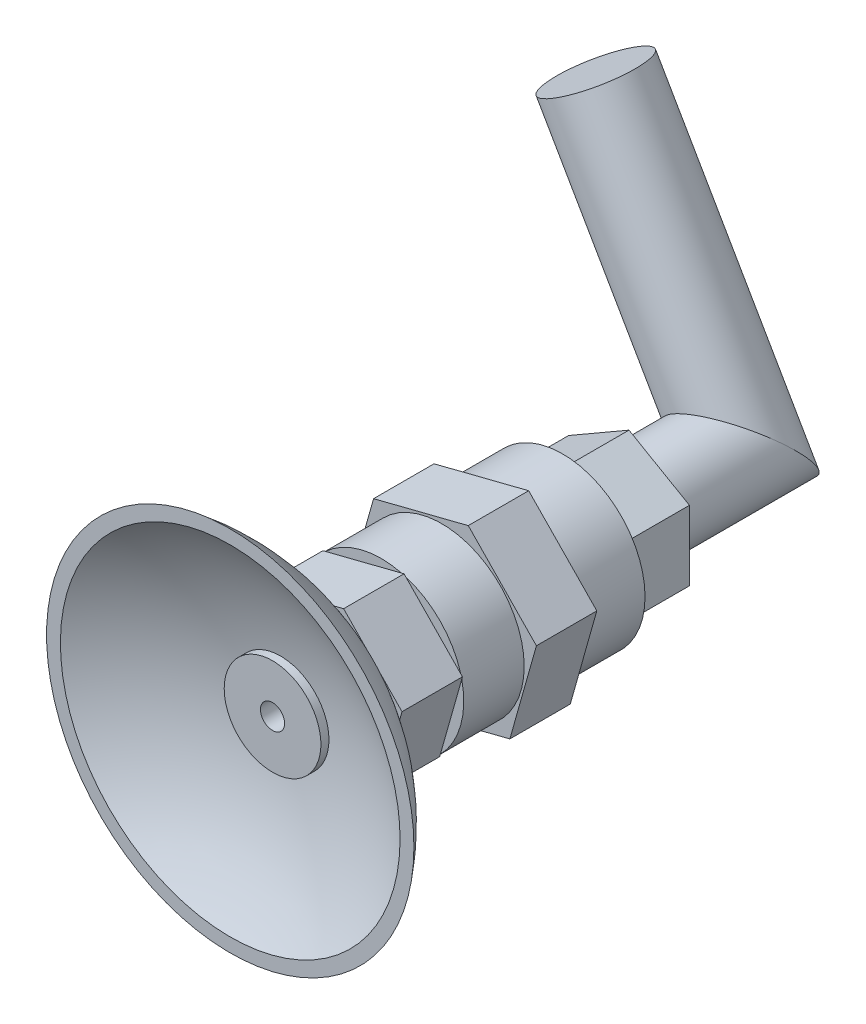
from build123d import *
from build123d.topology import SkipClean

# Parameters (mm, degrees)
ESQUISSE1_R             = 6.825
BOSS_EXTRU_1_DEPTH      = 5
BOSS_EXTRU_2_DEPTH      = 5
ESQUISSE3_R             = 6.825
BOSS_EXTRU_3_DEPTH      = 5
BOSS_EXTRU_4_DEPTH      = 5
ESQUISSE5_R             = 6
BOSS_EXTRU_5_DEPTH      = 1
ESQUISSE8_R             = 4
BOSS_EXTRU_6_DEPTH      = 4
COQUE1_START            = 3
COQUE1_OUTLINE_R        = 3
COQUE1_DEPTH            = 17.019936639
COQUE1_2_OUTLINE_R      = 3.825
COQUE1_2_OUTLINE_R_2    = 3
COQUE1_2_DEPTH          = 9
COQUE1_START_2          = 12
COQUE1_3_DEPTH          = 5
COQUE1_START_3          = 17
COQUE1_4_OUTLINE_R      = 1
COQUE1_4_DEPTH          = 7
BOSS_EXTRU_7_DEPTH      = 5.5
ESQUISSE11_R            = 3.75
BOSS_EXTRU_8_DEPTH      = 13
BOSS_EXTRU_9_DEPTH      = 19
BOSS_EXTRU_9_DEPTH_BACK = 11
ESQUISSE15_R            = 3.75
ENL_V_MAT_EXTRU_1_DEPTH = 36
ENL_V_MAT_EXTRU_2_DEPTH = 24


with BuildPart() as part:
    # Esquisse1 → Boss.-Extru.1 (new body)
    with BuildSketch(Plane.XY):
        Circle(ESQUISSE1_R)
    extrude(amount=BOSS_EXTRU_1_DEPTH)

    # Esquisse2 → Boss.-Extru.2 (add)
    with BuildSketch(Plane.XY.offset(5)):
        Polygon((2.197146908, 7.778552487), (-5.637850605, 5.792061282), (-7.834997513, -1.986491205), (-2.197146908, -7.778552487), (5.637850605, -5.792061282), (7.834997513, 1.986491205), align=None)
    extrude(amount=BOSS_EXTRU_2_DEPTH)

    # Esquisse3 → Boss.-Extru.3 (add)
    with BuildSketch(Plane.XY.offset(10)):
        Circle(ESQUISSE3_R)
    extrude(amount=BOSS_EXTRU_3_DEPTH)

    # Esquisse4 → Boss.-Extru.4 (add)
    with BuildSketch(Plane.XY.offset(15)):
        Polygon((1.883268778, 6.667330703), (-4.832443375, 4.964623956), (-6.715712154, -1.702706748), (-1.883268778, -6.667330703), (4.832443375, -4.964623956), (6.715712154, 1.702706748), align=None)
    extrude(amount=BOSS_EXTRU_4_DEPTH)

    # Esquisse5 → Boss.-Extru.5 (add)
    with BuildSketch(Plane.XY.offset(20)):
        with Locations(Location((0, 0, 0), (0, 0, 164.227020734))):
            Circle(ESQUISSE5_R)
    extrude(amount=BOSS_EXTRU_5_DEPTH)

    # Esquisse6 → Révolution1 (revolve)
    with BuildSketch(Plane(origin=(0, 0, 0), x_dir=(0, 0, 1), z_dir=(-0.9623462940986051, 0.2718264340248778, 0))):
        with BuildLine():
            Line((27.5, 15.2), (27.5, 14.053156671))
            ThreePointArc((27.5, 14.053156671), (24.153582084, 7.377792349), (23.001548337, 0))
            Line((23.001548337, 0), (20.000668758, 0))
            ThreePointArc((20.000668758, 0), (22.010684231, 8.458303467), (27.5, 15.2))
        make_face()
    revolve(axis=Axis((0, 0, 27.429189789), (0, 0, -1)))

    # Esquisse8 → Boss.-Extru.6 (add)
    with BuildSketch(Plane(origin=(0, 0, 20), x_dir=(-1, 0, 0), z_dir=(0, 0, -1))):
        Circle(ESQUISSE8_R)
    extrude(amount=-BOSS_EXTRU_6_DEPTH)

    # Coque1: read off the stored shape, not the designer's step
    # Coque1 outline → Coque1 (cut)
    with BuildSketch(Plane.XY.offset(COQUE1_START)):
        Circle(COQUE1_OUTLINE_R)
    extrude(amount=COQUE1_DEPTH, mode=Mode.SUBTRACT)

    # Coque1 2 outline → Coque1 2 (cut)
    with BuildSketch(Plane.XY.offset(COQUE1_START)):
        Circle(COQUE1_2_OUTLINE_R)
        Circle(COQUE1_2_OUTLINE_R_2, mode=Mode.SUBTRACT)
    extrude(amount=COQUE1_2_DEPTH, mode=Mode.SUBTRACT)

    # Coque1 3 outline → Coque1 3 (cut)
    with BuildSketch(Plane.XY.offset(COQUE1_START_2)):
        with BuildLine():
            Line((-2.887038883, 0.815479301), (-3.357856077, -0.851353374))
            Line((-3.357856077, -0.851353374), (-2.149745259, -2.092509336))
            ThreePointArc((-2.149745259, -2.092509336), (-2.907988669, -0.737293632), (-2.887038883, 0.815479301))
        make_face()
        with BuildLine():
            Line((-2.416221688, 2.482311978), (-2.887038883, 0.815479301))
            ThreePointArc((-2.887038883, 0.815479301), (-2.092509359, 2.149745237), (-0.737293637, 2.907988668))
            Line((-0.737293637, 2.907988668), (-2.416221688, 2.482311978))
        make_face()
        with BuildLine():
            ThreePointArc((0.737293647, -2.907988665), (-0.815479321, -2.887038877), (-2.149745259, -2.092509336))
            Line((-2.149745259, -2.092509336), (-0.941634389, -3.333665352))
            Line((-0.941634389, -3.333665352), (0.737293647, -2.907988665))
        make_face()
        with BuildLine():
            Line((0.941634389, 3.333665352), (-0.737293637, 2.907988668))
            ThreePointArc((-0.737293637, 2.907988668), (0.815479327, 2.887038875), (2.149745261, 2.092509334))
            Line((2.149745261, 2.092509334), (0.941634389, 3.333665352))
        make_face()
        with BuildLine():
            ThreePointArc((2.887038882, -0.815479302), (2.092509362, -2.149745234), (0.737293647, -2.907988665))
            Line((0.737293647, -2.907988665), (2.416221688, -2.482311978))
            Line((2.416221688, -2.482311978), (2.887038882, -0.815479302))
        make_face()
        with BuildLine():
            Line((3.357856077, 0.851353374), (2.149745261, 2.092509334))
            ThreePointArc((2.149745261, 2.092509334), (2.90798867, 0.73729363), (2.887038882, -0.815479302))
            Line((2.887038882, -0.815479302), (3.357856077, 0.851353374))
        make_face()
    extrude(amount=COQUE1_3_DEPTH, mode=Mode.SUBTRACT)

    # Coque1 4 outline → Coque1 4 (cut)
    with BuildSketch(Plane.XY.offset(COQUE1_START_3)):
        Circle(COQUE1_4_OUTLINE_R)
    extrude(amount=COQUE1_4_DEPTH, mode=Mode.SUBTRACT)

    # Coque1 5 outline → Coque1 5 (revolve, cut)
    with BuildSketch(Plane.XZ):
        with BuildLine():
            ThreePointArc((3.000000027, 20.167494226), (2.001360363, 20.075277066), (0.999999973, 20.019936738))
            Line((0.999999973, 20.019936738), (3, 20.019936639))
            Line((3, 20.019936639), (3.000000027, 20.167494226))
        make_face()
    revolve(axis=Axis((0, 0, 0), (0, 0, 1)), mode=Mode.SUBTRACT)

    # Esquisse10 → Boss.-Extru.7 (add)
    with BuildSketch(Plane(origin=(0, 0, 0), x_dir=(-1, 0, 0), z_dir=(0, 0, -1))):
        Polygon((5, -2.886751346), (5, 2.886751346), (0, 5.773502692), (-5, 2.886751346), (-5, -2.886751346), (0, -5.773502692), align=None)
    extrude(amount=BOSS_EXTRU_7_DEPTH)

    # Esquisse11 → Boss.-Extru.8 (add)
    with BuildSketch(Plane(origin=(0, 0, -5.5), x_dir=(-1, 0, 0), z_dir=(0, 0, -1))):
        with Locations(Location((0, 0, 0), (0, 0, 180))):
            Circle(ESQUISSE11_R)
    extrude(amount=BOSS_EXTRU_8_DEPTH)

    # Esquisse15 → Boss.-Extru.9 (add, two sides: drawn at the far end of the back side and taken through both)
    with BuildSketch(Plane(origin=(-2.5, 4.330127019, 0), x_dir=(0.8660254037844387, 0.4999999999999999, 0), z_dir=(-0.49999999999999994, 0.8660254037844388, 0)).offset(-BOSS_EXTRU_9_DEPTH_BACK)):
        with Locations(Location((0, 14.75, 0), (0, 0, 180))):
            Circle(ESQUISSE15_R)
    extrude(amount=BOSS_EXTRU_9_DEPTH + BOSS_EXTRU_9_DEPTH_BACK)

    # Esquisse17 → Enlèv. mat.-Extru.1 (cut)
    with BuildSketch(Plane(origin=(-12, 20.784609691, 0), x_dir=(0.8660254037844386, 0.5, 0), z_dir=(-0.5000000000000001, 0.8660254037844387, 0))):
        with BuildLine():
            Line((3.75, 14.75), (7.089373521, 14.75))
            Line((7.089373521, 14.75), (7.089373521, 20.468856948))
            Line((7.089373521, 20.468856948), (-7.00273048, 20.468856948))
            Line((-7.00273048, 20.468856948), (-7.00273048, 14.75))
            Line((-7.00273048, 14.75), (-3.75, 14.75))
            ThreePointArc((-3.75, 14.75), (0, 18.5), (3.75, 14.75))
        make_face()
    extrude(amount=-ENL_V_MAT_EXTRU_1_DEPTH, mode=Mode.SUBTRACT)

    # Esquisse18 → Enlèv. mat.-Extru.2 (cut)
    with SkipClean():  # the faces are left unmerged after this step: merging them gives an invalid solid
        with BuildSketch(Plane(origin=(0, 0, -5.5), x_dir=(-1, 0, 0), z_dir=(0, 0, -1))):
            with BuildLine():
                Line((14.892554705, -8.598220468), (3.247595264, -1.875))
                ThreePointArc((3.247595264, -1.875), (-1.875, -3.247595264), (-3.247595264, 1.875))
                Line((-3.247595264, 1.875), (-12.633967987, 7.294224818))
                Line((-12.633967987, 7.294224818), (-3.446061764, -21.412882035))
                Line((-3.446061764, -21.412882035), (14.892554705, -8.598220468))
            make_face()
        extrude(amount=ENL_V_MAT_EXTRU_2_DEPTH, mode=Mode.SUBTRACT)


solid = part.part
